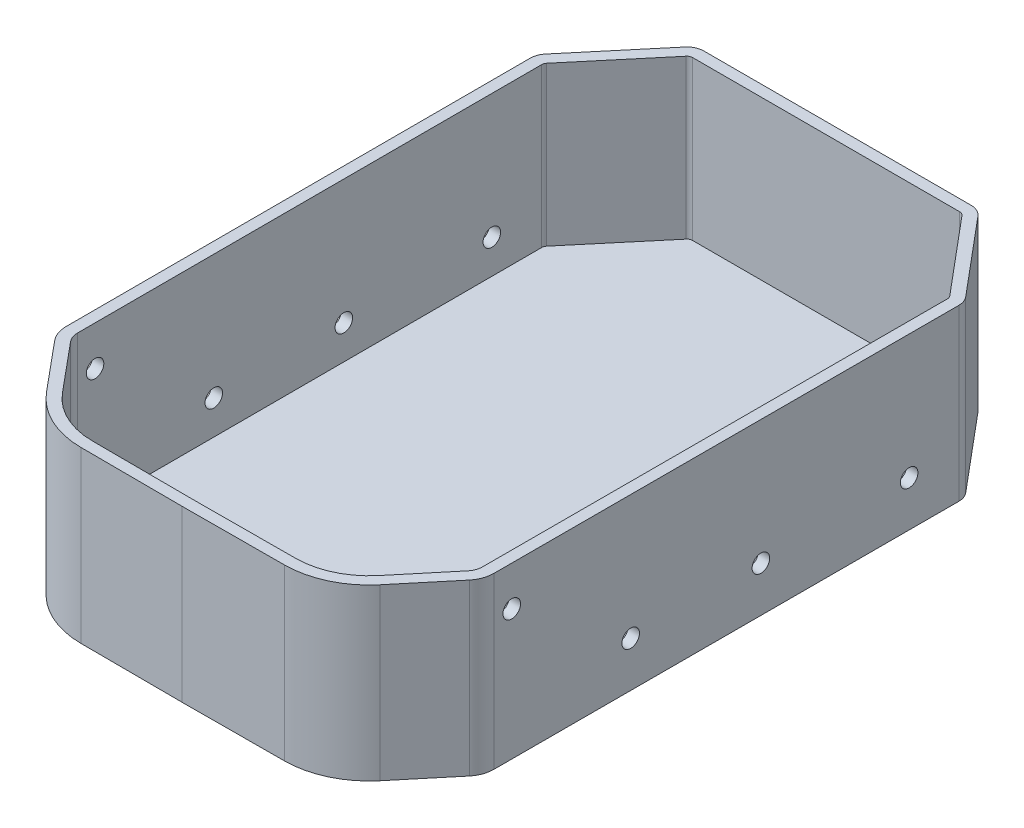
from build123d import *

# Parameters (mm, degrees)
AUFSATZ_LINEAR_AUSTRAGEN1_DEPTH = 30
VERRUNDUNG11_R                  = 15
VERRUNDUNG12_R                  = 5
VERRUNDUNG13_R                  = 3
VERRUNDUNG14_R                  = 3
WANDUNG4_T                      = -2
SCHNITT_LINEAR_AUSTRAGEN1_REACH = 113.186
SKIZZE7_R                       = 1.55


with BuildPart() as part:
    # Skizze1 → Aufsatz-Linear austragen1 (new body)
    with BuildSketch(Plane(origin=(0, 0, 0), x_dir=(1, 0, 0), z_dir=(0, 1, 0))):
        Polygon((0, -75.745036748), (-24.999786643, -75.641751751), (-37.792132404, -60.267881388), (-37.855752194, 24.732118612), (-25, 40.053007474), (0, 40.053007474), align=None)
    aufsatz_linear_austragen1 = extrude(amount=AUFSATZ_LINEAR_AUSTRAGEN1_DEPTH)

    # Spiegeln1: Aufsatz-Linear austragen1 across plane
    add(aufsatz_linear_austragen1.mirror(Plane(origin=(0, 0, 0), x_dir=(0, 0, 1), z_dir=(1, 0, 0))))

    # Verrundung11
    verrundung11_edges = [part.edges().sort_by_distance(p)[0] for p in [
        (-24.999786643, 15, 75.641751751),
        (24.999786643, 15, 75.641751751),
    ]]
    fillet(verrundung11_edges, radius=VERRUNDUNG11_R)

    # Verrundung12
    verrundung12_edges = [part.edges().sort_by_distance(p)[0] for p in [
        (37.792132404, 15, 60.267881388),
        (-37.792132404, 15, 60.267881388),
    ]]
    fillet(verrundung12_edges, radius=VERRUNDUNG12_R)

    # Verrundung13
    verrundung13_edges = [part.edges().sort_by_distance(p)[0] for p in [
        (-25, 15, -40.053007474),
        (25, 15, -40.053007474),
    ]]
    fillet(verrundung13_edges, radius=VERRUNDUNG13_R)

    # Verrundung14
    verrundung14_edges = [part.edges().sort_by_distance(p)[0] for p in [
        (37.855752194, 15, -24.732118612),
        (-37.855752194, 15, -24.732118612),
    ]]
    fillet(verrundung14_edges, radius=VERRUNDUNG14_R)

    # Wandung4
    wandung4_openings = [part.faces().sort_by_distance(p)[0] for p in [
        (0, 30, 17.703317915),
    ]]
    offset(amount=WANDUNG4_T, openings=wandung4_openings, kind=Kind.INTERSECTION)

    # Schnitt-Linear austragen1: up to this plane
    schnitt_linear_austragen1_end = Plane(origin=(37.792132404, 30, 60.267881388), z_dir=(0.9999997198978612, 0, 0.0007484679012413468))
    # Skizze7 → Schnitt-Linear austragen1 (cut, up to the surface)
    with BuildSketch(Plane(origin=(-37.837219795, 0, 0.028319952), x_dir=(0.0007484679012413468, 0, 0.9999997198978612), z_dir=(-0.9999997198978612, 0, 0.0007484679012413468)), mode=Mode.PRIVATE) as schnitt_linear_austragen1_sk1:
        with Locations((-14.847263192, 8)):
            Circle(SKIZZE7_R)
    schnitt_linear_austragen1_tool1 = split(extrude(schnitt_linear_austragen1_sk1.sketch, amount=-SCHNITT_LINEAR_AUSTRAGEN1_REACH, mode=Mode.PRIVATE), bisect_by=schnitt_linear_austragen1_end, keep=Keep.BOTH, mode=Mode.PRIVATE)
    add(schnitt_linear_austragen1_tool1.solids().sort_by_distance((-37.848332, 8, -14.818939))[0], mode=Mode.SUBTRACT)
    # Skizze7 → Schnitt-Linear austragen1 (cut, up to the surface)
    with BuildSketch(Plane(origin=(-37.837219795, 0, 0.028319952), x_dir=(0.0007484679012413468, 0, 0.9999997198978612), z_dir=(-0.9999997198978612, 0, 0.0007484679012413468)), mode=Mode.PRIVATE) as schnitt_linear_austragen1_sk2:
        with Locations((11.332736808, 8)):
            Circle(SKIZZE7_R)
    schnitt_linear_austragen1_tool2 = split(extrude(schnitt_linear_austragen1_sk2.sketch, amount=-SCHNITT_LINEAR_AUSTRAGEN1_REACH, mode=Mode.PRIVATE), bisect_by=schnitt_linear_austragen1_end, keep=Keep.BOTH, mode=Mode.PRIVATE)
    add(schnitt_linear_austragen1_tool2.solids().sort_by_distance((-37.828738, 8, 11.361054))[0], mode=Mode.SUBTRACT)
    # Skizze7 → Schnitt-Linear austragen1 (cut, up to the surface)
    with BuildSketch(Plane(origin=(-37.837219795, 0, 0.028319952), x_dir=(0.0007484679012413468, 0, 0.9999997198978612), z_dir=(-0.9999997198978612, 0, 0.0007484679012413468)), mode=Mode.PRIVATE) as schnitt_linear_austragen1_sk3:
        with Locations((34.332736808, 8)):
            Circle(SKIZZE7_R)
    schnitt_linear_austragen1_tool3 = split(extrude(schnitt_linear_austragen1_sk3.sketch, amount=-SCHNITT_LINEAR_AUSTRAGEN1_REACH, mode=Mode.PRIVATE), bisect_by=schnitt_linear_austragen1_end, keep=Keep.BOTH, mode=Mode.PRIVATE)
    add(schnitt_linear_austragen1_tool3.solids().sort_by_distance((-37.811523, 8, 34.361047))[0], mode=Mode.SUBTRACT)
    # Skizze7 → Schnitt-Linear austragen1 (cut, up to the surface)
    with BuildSketch(Plane(origin=(-37.837219795, 0, 0.028319952), x_dir=(0.0007484679012413468, 0, 0.9999997198978612), z_dir=(-0.9999997198978612, 0, 0.0007484679012413468)), mode=Mode.PRIVATE) as schnitt_linear_austragen1_sk4:
        with Locations((55.332736808, 23)):
            Circle(SKIZZE7_R)
    schnitt_linear_austragen1_tool4 = split(extrude(schnitt_linear_austragen1_sk4.sketch, amount=-SCHNITT_LINEAR_AUSTRAGEN1_REACH, mode=Mode.PRIVATE), bisect_by=schnitt_linear_austragen1_end, keep=Keep.BOTH, mode=Mode.PRIVATE)
    add(schnitt_linear_austragen1_tool4.solids().sort_by_distance((-37.795805, 23, 55.361041))[0], mode=Mode.SUBTRACT)


solid = part.part
